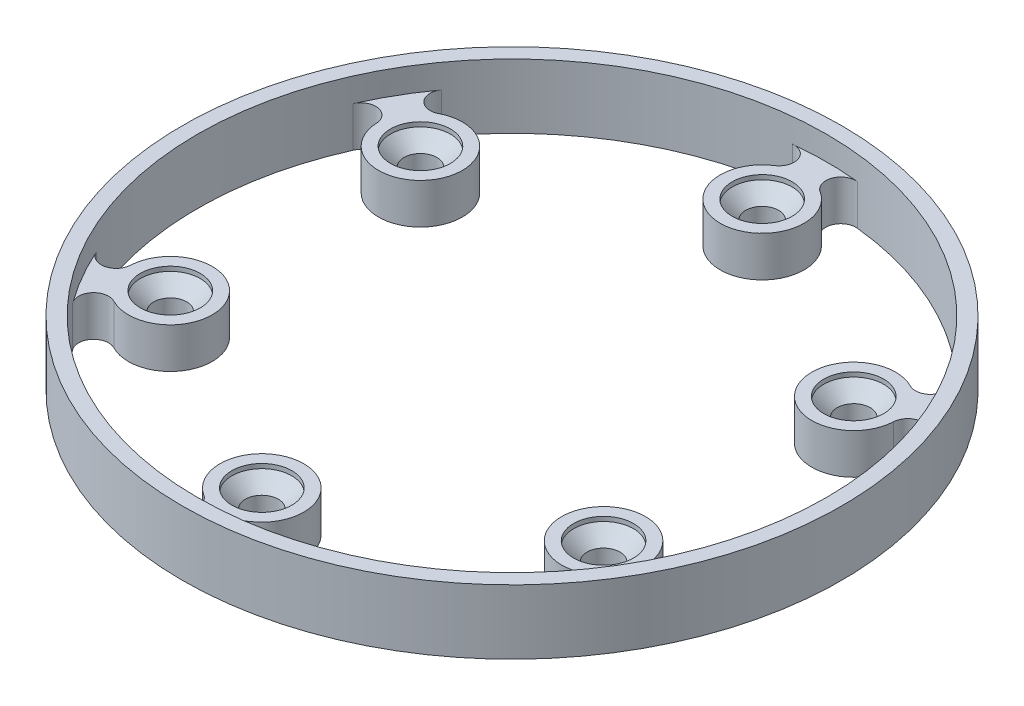
from build123d import *

# Parameters (mm, degrees)
SKETCH1_R                        = 22
BASE_SHAPE_DEPTH                 = 4.3
BASE_CUT_REACH                   = 33.408
SKETCH4_R                        = 2.1
MILLING_FILLETS_R                = 1
REMOVE_INNER_2_REACH             = 33.408
SKETCH11_R                       = 21
CUT_EXTRUDE2_DEPTH               = 1.6
OUTER_M2_COUNTERSUNKS_AT_2_COUNT = 2
OUTER_M2_COUNTERSUNKS_AT_2_PITCH = 16.7
OUTER_M2_COUNTERSUNKS_AT_3_COUNT = 2
OUTER_M2_COUNTERSUNKS_AT_3_PITCH = 28.925248486
OUTER_M2_COUNTERSUNKS_AT_4_COUNT = 2
OUTER_M2_COUNTERSUNKS_AT_4_PITCH = 33.4
OUTER_M2_COUNTERSUNKS_AT_5_COUNT = 2
OUTER_M2_COUNTERSUNKS_AT_5_PITCH = 28.925248486
OUTER_M2_COUNTERSUNKS_AT_6_COUNT = 2
OUTER_M2_COUNTERSUNKS_AT_6_PITCH = 16.7


with BuildPart() as part:
    # Sketch1 → Base shape (new body)
    with BuildSketch(Plane(origin=(0, 0, 0), x_dir=(1, 0, 0), z_dir=(0, 1, 0))):
        Circle(SKETCH1_R)
    extrude(amount=BASE_SHAPE_DEPTH)

    # Sketch4 → Base cut (cut, up to next)
    with BuildSketch(Plane(origin=(0, 4.3, 0), x_dir=(1, 0, 0), z_dir=(0, 1, 0)), mode=Mode.PRIVATE) as base_cut_sk1:
        with BuildLine():
            Line((-0.5, 4.623040125), (-0.5, 13.945004537))
            ThreePointArc((-0.5, 13.945004537), (-2.746076212, 16.153131244), (-1.517286534, 19.053261901))
            ThreePointArc((-1.517286534, 19.053261901), (-1.115725557, 20.225230181), (-2.162133235, 20.888398212))
            ThreePointArc((-2.162133235, 20.888398212), (-10.500000003, 18.186533478), (-17.008816883, 12.316661408))
            ThreePointArc((-17.008816883, 12.316661408), (-16.957700355, 11.078861766), (-15.74196557, 10.84063963))
            ThreePointArc((-15.74196557, 10.84063963), (-12.615983904, 10.454737385), (-11.826728185, 7.40551497))
            Line((-11.826728185, 7.40551497), (-3.753670191, 2.744532765))
            ThreePointArc((-3.753670191, 2.744532765), (-2.325, 4.027018128), (-0.5, 4.623040125))
        make_face()
    base_cut_tool1 = extrude(base_cut_sk1.sketch, amount=-BASE_CUT_REACH, mode=Mode.PRIVATE) & part.part
    # Sketch4 → Base cut (cut, up to next)
    with BuildSketch(Plane(origin=(0, 4.3, 0), x_dir=(1, 0, 0), z_dir=(0, 1, 0)), mode=Mode.PRIVATE) as base_cut_sk2:
        with BuildLine():
            Line((0.5, 13.945004537), (0.5, 4.623040125))
            ThreePointArc((0.5, 4.623040125), (2.325, 4.027018128), (3.753670191, 2.744532765))
            Line((3.753670191, 2.744532765), (11.826728185, 7.40551497))
            ThreePointArc((11.826728185, 7.40551497), (12.615983941, 10.454737417), (15.741965657, 10.840639586))
            ThreePointArc((15.741965657, 10.840639586), (16.957700372, 11.078861786), (17.00881691, 12.316661371))
            ThreePointArc((17.00881691, 12.316661371), (10.500000058, 18.186533446), (2.162133314, 20.888398204))
            ThreePointArc((2.162133314, 20.888398204), (1.11572557, 20.225230219), (1.517286532, 19.053261902))
            ThreePointArc((1.517286532, 19.053261902), (2.746076212, 16.153131245), (0.5, 13.945004537))
        make_face()
    base_cut_tool2 = extrude(base_cut_sk2.sketch, amount=-BASE_CUT_REACH, mode=Mode.PRIVATE) & part.part
    # Sketch4 → Base cut (cut, up to next)
    with BuildSketch(Plane(origin=(0, 4.3, 0), x_dir=(1, 0, 0), z_dir=(0, 1, 0)), mode=Mode.PRIVATE) as base_cut_sk3:
        with BuildLine():
            ThreePointArc((-4.253670191, -1.878507361), (-4.65, 0), (-4.253670191, 1.878507361))
            Line((-4.253670191, 1.878507361), (-12.326728185, 6.539489567))
            ThreePointArc((-12.326728185, 6.539489567), (-15.362060141, 5.698393871), (-17.259252101, 8.212622326))
            ThreePointArc((-17.259252101, 8.212622326), (-18.073426017, 9.146368434), (-19.170950177, 8.571736657))
            ThreePointArc((-19.170950177, 8.571736657), (-21, -2.3e-08), (-19.170950158, -8.571736698))
            ThreePointArc((-19.170950158, -8.571736698), (-18.073425944, -9.146368421), (-17.259252096, -8.212622223))
            ThreePointArc((-17.259252096, -8.212622223), (-15.362060093, -5.698393854), (-12.326728185, -6.539489567))
            Line((-12.326728185, -6.539489567), (-4.253670191, -1.878507361))
        make_face()
    base_cut_tool3 = extrude(base_cut_sk3.sketch, amount=-BASE_CUT_REACH, mode=Mode.PRIVATE) & part.part
    # Sketch4 → Base cut (cut, up to next)
    with BuildSketch(Plane(origin=(0, 4.3, 0), x_dir=(1, 0, 0), z_dir=(0, 1, 0)), mode=Mode.PRIVATE) as base_cut_sk4:
        with BuildLine():
            Line((12.326728185, 6.539489567), (4.253670191, 1.878507361))
            ThreePointArc((4.253670191, 1.878507361), (4.65, 0), (4.253670191, -1.878507361))
            Line((4.253670191, -1.878507361), (12.326728185, -6.539489567))
            ThreePointArc((12.326728185, -6.539489567), (15.362060141, -5.698393871), (17.259252101, -8.212622326))
            ThreePointArc((17.259252101, -8.212622326), (18.07342595, -9.146368422), (19.170950121, -8.571736781))
            ThreePointArc((19.170950121, -8.571736781), (21, -9e-09), (19.170950128, 8.571736765))
            ThreePointArc((19.170950128, 8.571736765), (18.073425908, 9.146368414), (17.259252096, 8.212622223))
            ThreePointArc((17.259252096, 8.212622223), (15.362060093, 5.698393854), (12.326728185, 6.539489567))
        make_face()
    base_cut_tool4 = extrude(base_cut_sk4.sketch, amount=-BASE_CUT_REACH, mode=Mode.PRIVATE) & part.part
    # Sketch4 → Base cut (cut, up to next)
    with BuildSketch(Plane(origin=(0, 4.3, 0), x_dir=(1, 0, 0), z_dir=(0, 1, 0)), mode=Mode.PRIVATE) as base_cut_sk5:
        with BuildLine():
            ThreePointArc((-0.5, -4.623040125), (-2.325, -4.027018128), (-3.753670191, -2.744532765))
            Line((-3.753670191, -2.744532765), (-11.826728185, -7.40551497))
            ThreePointArc((-11.826728185, -7.40551497), (-12.615983918, -10.454737397), (-15.741965602, -10.840639614))
            ThreePointArc((-15.741965602, -10.840639614), (-16.957700382, -11.078861797), (-17.008816856, -12.316661445))
            ThreePointArc((-17.008816856, -12.316661445), (-10.500000018, -18.186533469), (-2.162133314, -20.888398204))
            ThreePointArc((-2.162133314, -20.888398204), (-1.115725572, -20.225230224), (-1.517286523, -19.053261908))
            ThreePointArc((-1.517286523, -19.053261908), (-2.746076213, -16.15313125), (-0.5, -13.945004537))
            Line((-0.5, -13.945004537), (-0.5, -4.623040125))
        make_face()
    base_cut_tool5 = extrude(base_cut_sk5.sketch, amount=-BASE_CUT_REACH, mode=Mode.PRIVATE) & part.part
    # Sketch4 → Base cut (cut, up to next)
    with BuildSketch(Plane(origin=(0, 4.3, 0), x_dir=(1, 0, 0), z_dir=(0, 1, 0)), mode=Mode.PRIVATE) as base_cut_sk6:
        with BuildLine():
            Line((11.826728185, -7.40551497), (3.753670191, -2.744532765))
            ThreePointArc((3.753670191, -2.744532765), (2.325, -4.027018128), (0.5, -4.623040125))
            Line((0.5, -4.623040125), (0.5, -13.945004537))
            ThreePointArc((0.5, -13.945004537), (2.746076211, -16.15313124), (1.51728654, -19.053261897))
            ThreePointArc((1.51728654, -19.053261897), (1.115725569, -20.225230215), (2.162133314, -20.888398204))
            ThreePointArc((2.162133314, -20.888398204), (10.499999986, -18.186533488), (17.008816813, -12.316661505))
            ThreePointArc((17.008816813, -12.316661505), (16.957700403, -11.078861822), (15.741965594, -10.840639618))
            ThreePointArc((15.741965594, -10.840639618), (12.615983914, -10.454737394), (11.826728185, -7.40551497))
        make_face()
    base_cut_tool6 = extrude(base_cut_sk6.sketch, amount=-BASE_CUT_REACH, mode=Mode.PRIVATE) & part.part
    # Sketch4 → Base cut (cut, up to next)
    with BuildSketch(Plane(origin=(0, 4.3, 0), x_dir=(1, 0, 0), z_dir=(0, 1, 0)), mode=Mode.PRIVATE) as base_cut_sk7:
        Circle(SKETCH4_R)
    base_cut_tool7 = extrude(base_cut_sk7.sketch, amount=-BASE_CUT_REACH, mode=Mode.PRIVATE) & part.part
    add(base_cut_tool1.solids().sort_by_distance((-6.978507, 4.3, -12.087128))[0], mode=Mode.SUBTRACT)
    add(base_cut_tool2.solids().sort_by_distance((6.978507, 4.3, -12.087128))[0], mode=Mode.SUBTRACT)
    add(base_cut_tool3.solids().sort_by_distance((-13.957013, 4.3, 0))[0], mode=Mode.SUBTRACT)
    add(base_cut_tool4.solids().sort_by_distance((13.957013, 4.3, 0))[0], mode=Mode.SUBTRACT)
    add(base_cut_tool5.solids().sort_by_distance((-6.978507, 4.3, 12.087128))[0], mode=Mode.SUBTRACT)
    add(base_cut_tool6.solids().sort_by_distance((6.978507, 4.3, 12.087128))[0], mode=Mode.SUBTRACT)
    add(base_cut_tool7.solids().sort_by_distance((0, 4.3, 0))[0], mode=Mode.SUBTRACT)

    # Milling fillets
    milling_fillets_edges = [part.edges().sort_by_distance(p)[0] for p in [
        (11.826728185, 2.15, 7.40551497),
        (0.5, 2.15, 4.623040125),
        (12.326728185, 2.15, -6.539489567),
        (-0.5, 2.15, -4.623040125),
        (11.826728185, 2.15, -7.40551497),
        (0.5, 2.15, -4.623040125),
        (4.253670191, 2.15, 1.878507361),
        (0.5, 2.15, -13.945004537),
        (-11.826728185, 2.15, 7.40551497),
        (0.5, 2.15, 13.945004537),
        (3.753670191, 2.15, 2.744532765),
        (-0.5, 2.15, 4.623040125),
        (-0.5, 2.15, -13.945004537),
        (-0.5, 2.15, 13.945004537),
        (12.326728185, 2.15, 6.539489567),
        (3.753670191, 2.15, -2.744532765),
        (-4.253670191, 2.15, 1.878507361),
        (-12.326728185, 2.15, 6.539489567),
        (-3.753670191, 2.15, -2.744532765),
        (-11.826728185, 2.15, -7.40551497),
        (-12.326728185, 2.15, -6.539489567),
        (-4.253670191, 2.15, -1.878507361),
        (4.253670191, 2.15, -1.878507361),
        (-3.753670191, 2.15, 2.744532765),
    ]]
    fillet(milling_fillets_edges, radius=MILLING_FILLETS_R)

    # Sketch10 → Remove inner 2 (cut, up to next)
    with BuildSketch(Plane(origin=(0, 4.3, 0), x_dir=(1, 0, 0), z_dir=(0, 1, 0)), mode=Mode.PRIVATE) as remove_inner_2_sk1:
        with BuildLine():
            ThreePointArc((15.654413457, -5.816299452), (16.436524948, -2.954766934), (16.7, 0))
            ThreePointArc((16.7, 0), (16.436524948, 2.954766934), (15.654413457, 5.816299452))
            ThreePointArc((15.654413457, 5.816299452), (12.037753113, 6.95), (12.86426981, 10.64897001))
            ThreePointArc((12.86426981, 10.64897001), (8.35, 14.462624243), (2.790143648, 16.465269461))
            ThreePointArc((2.790143648, 16.465269461), (0, 13.9), (-2.790143648, 16.465269461))
            ThreePointArc((-2.790143648, 16.465269461), (-8.35, 14.462624243), (-12.86426981, 10.64897001))
            ThreePointArc((-12.86426981, 10.64897001), (-11.98115367, 9.647036543), (-11.662624243, 8.35))
            ThreePointArc((-11.662624243, 8.35), (-12.962125959, 5.985998118), (-15.654413457, 5.816299452))
            ThreePointArc((-15.654413457, 5.816299452), (-16.7, 0), (-15.654413457, -5.816299452))
            ThreePointArc((-15.654413457, -5.816299452), (-12.962125959, -5.985998118), (-11.662624243, -8.35))
            ThreePointArc((-11.662624243, -8.35), (-11.98115367, -9.647036543), (-12.86426981, -10.64897001))
            ThreePointArc((-12.86426981, -10.64897001), (-8.35, -14.462624243), (-2.790143648, -16.465269461))
            ThreePointArc((-2.790143648, -16.465269461), (0, -13.9), (2.790143648, -16.465269461))
            ThreePointArc((2.790143648, -16.465269461), (8.35, -14.462624243), (12.86426981, -10.64897001))
            ThreePointArc((12.86426981, -10.64897001), (12.037753113, -6.95), (15.654413457, -5.816299452))
        make_face()
    remove_inner_2_tool1 = extrude(remove_inner_2_sk1.sketch, amount=-REMOVE_INNER_2_REACH, mode=Mode.PRIVATE) & part.part
    add(remove_inner_2_tool1.solids().sort_by_distance((0, 4.3, 0))[0], mode=Mode.SUBTRACT)

    # Sketch11 → Cut-Extrude2 (cut)
    with BuildSketch(Plane(origin=(0, 4.3, 0), x_dir=(1, 0, 0), z_dir=(0, 1, 0))):
        Circle(SKETCH11_R)
    extrude(amount=-CUT_EXTRUDE2_DEPTH, mode=Mode.SUBTRACT)

    # Sketch8 → Outer M2 countersunks (revolve, cut)
    with BuildSketch(Plane(origin=(-14.462624243, 2.7, -8.35), x_dir=(0, 0, 1), z_dir=(1, 0, 0))):
        Polygon((0, 0), (0, 2.7), (1.1, 2.7), (1.1, 1.2), (2, 0.3), (2, 0), align=None)
    outer_m2_countersunks = revolve(axis=Axis((-14.462624243, 9.05, -8.35), (0, -1, 0)), mode=Mode.SUBTRACT)

    # Outer M2 countersunks at 2: Outer M2 countersunks ×2
    with Locations(*[Vector(0.8660254037844385, 0, -0.5000000000000004) * (i * OUTER_M2_COUNTERSUNKS_AT_2_PITCH) for i in range(1, OUTER_M2_COUNTERSUNKS_AT_2_COUNT)]):
        add(outer_m2_countersunks, mode=Mode.SUBTRACT)

    # Outer M2 countersunks at 3: Outer M2 countersunks ×2
    with Locations(*[(i * OUTER_M2_COUNTERSUNKS_AT_3_PITCH, 0, 0) for i in range(1, OUTER_M2_COUNTERSUNKS_AT_3_COUNT)]):
        add(outer_m2_countersunks, mode=Mode.SUBTRACT)

    # Outer M2 countersunks at 4: Outer M2 countersunks ×2
    with Locations(*[Vector(0.866025403784439, 0, 0.49999999999999944) * (i * OUTER_M2_COUNTERSUNKS_AT_4_PITCH) for i in range(1, OUTER_M2_COUNTERSUNKS_AT_4_COUNT)]):
        add(outer_m2_countersunks, mode=Mode.SUBTRACT)

    # Outer M2 countersunks at 5: Outer M2 countersunks ×2
    with Locations(*[Vector(0.5000000000000004, 0, 0.8660254037844384) * (i * OUTER_M2_COUNTERSUNKS_AT_5_PITCH) for i in range(1, OUTER_M2_COUNTERSUNKS_AT_5_COUNT)]):
        add(outer_m2_countersunks, mode=Mode.SUBTRACT)

    # Outer M2 countersunks at 6: Outer M2 countersunks ×2
    with Locations(*[(0, 0, i * OUTER_M2_COUNTERSUNKS_AT_6_PITCH) for i in range(1, OUTER_M2_COUNTERSUNKS_AT_6_COUNT)]):
        add(outer_m2_countersunks, mode=Mode.SUBTRACT)


solid = part.part
